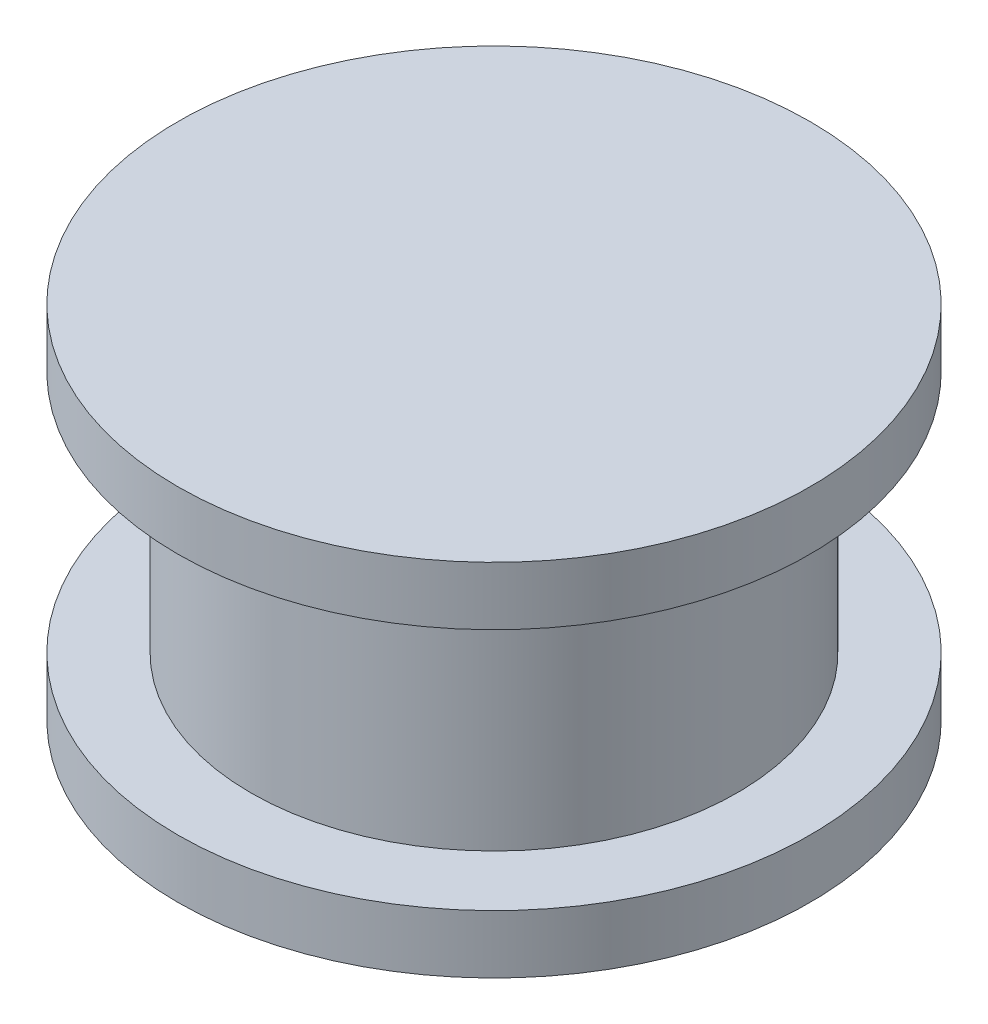
from build123d import *

# Parameters (mm, degrees)
SKETCH1_R           = 5
BOSS_EXTRUDE1_DEPTH = 5
SKETCH2_R           = 6.5
BOSS_EXTRUDE2_DEPTH = 1.2
BOSS_EXTRUDE3_START = 1.2
SKETCH3_R           = 6.5
BOSS_EXTRUDE3_DEPTH = 1.2


with BuildPart() as part:
    # Sketch1 → Boss-Extrude1 (new body)
    with BuildSketch(Plane(origin=(0, 0, 0), x_dir=(1, 0, 0), z_dir=(0, 1, 0))):
        Circle(SKETCH1_R)
    extrude(amount=BOSS_EXTRUDE1_DEPTH)

    # Sketch2 → Boss-Extrude2 (add)
    with BuildSketch(Plane(origin=(0, 5, 0), x_dir=(1, 0, 0), z_dir=(0, 1, 0))):
        Circle(SKETCH2_R)
    extrude(amount=BOSS_EXTRUDE2_DEPTH)

    # Sketch3 → Boss-Extrude3 (add)
    with BuildSketch(Plane.XZ.offset(BOSS_EXTRUDE3_START)):
        Circle(SKETCH3_R)
    extrude(amount=-BOSS_EXTRUDE3_DEPTH)


solid = part.part
